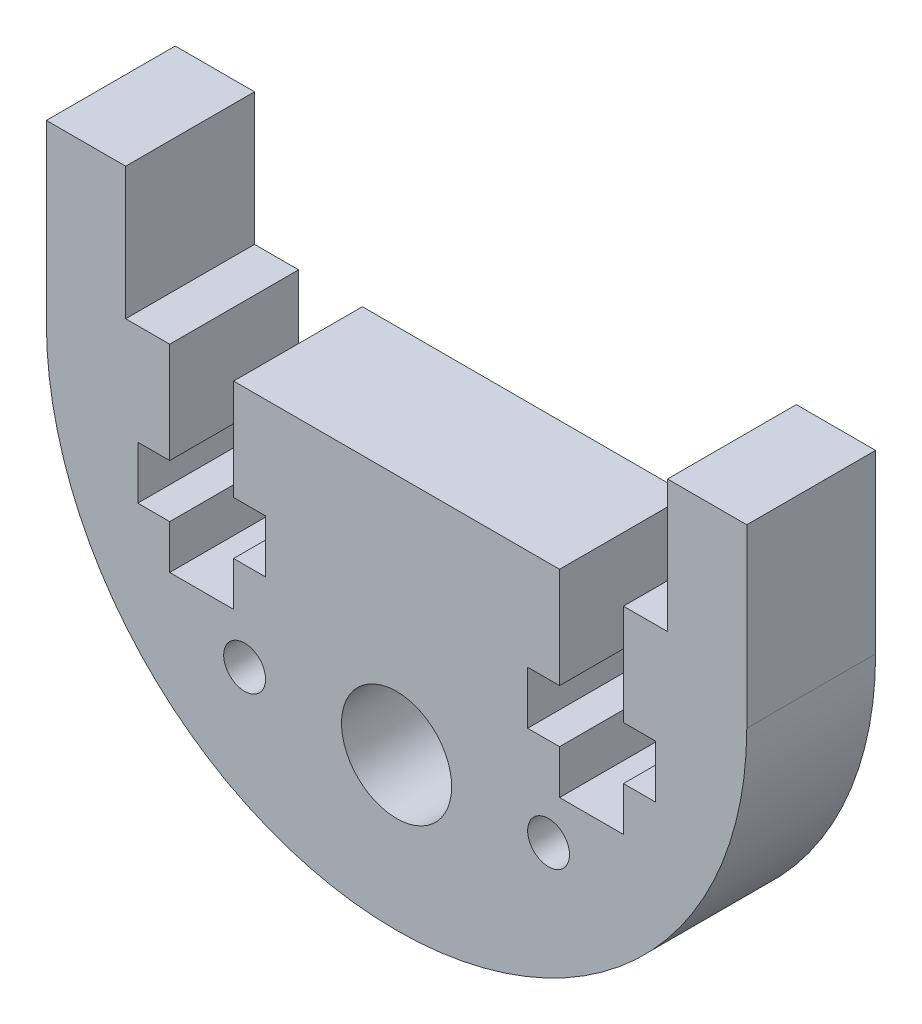
from build123d import *

# Parameters (mm, degrees)
MODEL_R             = 0.95
MODEL_R_2           = 2.5
BOSS_EXTRUDE2_DEPTH = 5.85


with BuildPart() as part:
    # Model → Boss-Extrude2 (new body)
    with BuildSketch(Plane.XY):
        with BuildLine():
            Line((553.509477136, 558.532469), (546.109477136, 558.532469))
            Line((546.109477136, 558.532469), (546.109477136, 553.956563))
            Line((546.109477136, 553.956563), (547.559477136, 553.956563))
            Line((547.559477136, 553.956563), (547.559477136, 551.556511944))
            Line((547.559477136, 551.556511944), (546.109477136, 551.556511944))
            Line((546.109477136, 551.556511944), (546.109477136, 549.556511944))
            Line((546.109477136, 549.556511944), (543.209477136, 549.556511944))
            Line((543.209477136, 549.556511944), (543.209477136, 551.556511944))
            Line((543.209477136, 551.556511944), (541.759477136, 551.556511944))
            Line((541.759477136, 551.556511944), (541.759477136, 553.956563))
            Line((541.759477136, 553.956563), (543.209477136, 553.956563))
            Line((543.209477136, 553.956563), (543.209477136, 558.532469))
            Line((543.209477136, 558.532469), (541.209477136, 558.532469))
            Line((541.209477136, 558.532469), (541.209477136, 564.532469))
            Line((541.209477136, 564.532469), (537.609477136, 564.532469))
            Line((537.609477136, 564.532469), (537.609477136, 556.532469))
            ThreePointArc((537.609477136, 556.532469), (553.509477136, 540.632469), (569.409477136, 556.532469))
            Line((569.409477136, 556.532469), (569.409477136, 564.532469))
            Line((569.409477136, 564.532469), (565.809477136, 564.532469))
            Line((565.809477136, 564.532469), (565.809477136, 558.532469))
            Line((565.809477136, 558.532469), (563.809477136, 558.532469))
            Line((563.809477136, 558.532469), (563.809477136, 553.956563))
            Line((563.809477136, 553.956563), (565.259477136, 553.956563))
            Line((565.259477136, 553.956563), (565.259477136, 551.556511944))
            Line((565.259477136, 551.556511944), (563.809477136, 551.556511944))
            Line((563.809477136, 551.556511944), (563.809477136, 549.556511944))
            Line((563.809477136, 549.556511944), (560.909477136, 549.556511944))
            Line((560.909477136, 549.556511944), (560.909477136, 551.556511944))
            Line((560.909477136, 551.556511944), (559.459477136, 551.556511944))
            Line((559.459477136, 551.556511944), (559.459477136, 553.956563))
            Line((559.459477136, 553.956563), (560.909477136, 553.956563))
            Line((560.909477136, 553.956563), (560.909477136, 558.532469))
            Line((560.909477136, 558.532469), (553.509477136, 558.532469))
        make_face()
        with Locations((546.609477136, 547.532469)):
            Circle(MODEL_R, mode=Mode.SUBTRACT)
        with Locations((553.509477136, 547.532469)):
            Circle(MODEL_R_2, mode=Mode.SUBTRACT)
        with Locations((560.409477136, 547.532469)):
            Circle(MODEL_R, mode=Mode.SUBTRACT)
    extrude(amount=BOSS_EXTRUDE2_DEPTH)


solid = part.part
